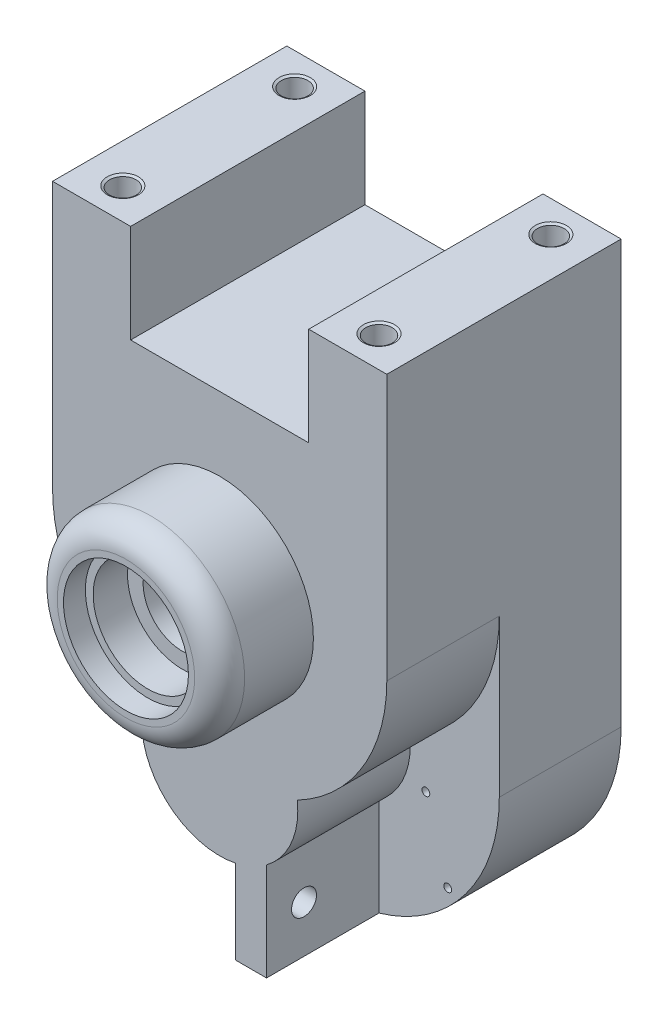
from build123d import *

# Parameters (mm, degrees)
EXTRUS_O1_DEPTH                      = 36
ESBO_O2_R                            = 30
EXTRUS_O3_DEPTH                      = 30
EXTRUS_O4_START                      = 39
EXTRUS_O4_DEPTH                      = 39
ESBO_O4_R                            = 20
CORTE_EXTRUS_O1_DEPTH                = 7
CORTE_EXTRUS_O3_DEPTH                = 67
ESBO_O7_R                            = 43.5
CORTE_EXTRUS_O4_DEPTH                = 31
EXTRUS_O5_START                      = 6
ESBO_O8_R                            = 30
EXTRUS_O5_DEPTH                      = 6
EXTRUS_O6_START                      = 6
ESBO_O9_R                            = 25
EXTRUS_O6_DEPTH                      = 6
ESBO_O10_R                           = 17.5
CORTE_EXTRUS_O5_DEPTH                = 9
ESBO_O5_R                            = 12.5
CORTE_EXTRUS_O2_DEPTH                = 153.414935292
ESBO_O11_R                           = 16
CORTE_EXTRUS_O6_DEPTH                = 9
ESBO_O12_R                           = 13
CORTE_EXTRUS_O7_DEPTH                = 2
CORTE_EXTRUS_O8_START                = -11
ESBO_O13_R                           = 17.5
CORTE_EXTRUS_O8_DEPTH                = 11
FILETE1_R                            = 5
FILETE2_R                            = 8
FURO_DE_DI_METRO_4_5_4_5_1_D         = 4.5
FURO_DE_DI_METRO_4_5_4_5_1_DEPTH     = 15
FURO_DE_DI_METRO_4_5_4_5_1_TIP       = 1.351936393
ESBO_O18_R                           = 2.5
CORTE_EXTRUS_O9_DEPTH                = 12
FURO_ROSCADO_DE_M10X1_51_D           = 8.5
FURO_ROSCADO_DE_M10X1_51_DEPTH       = 27.5
FURO_ROSCADO_DE_M10X1_51_CSINK_D     = 10
FURO_ROSCADO_DE_M10X1_51_CSINK_ANGLE = 118
FURO_ROSCADO_DE_M10X1_51_TIP         = 2.553657631
EXTRUS_O8_DEPTH                      = 36
ESBO_O24_R                           = 4
CORTE_EXTRUS_O12_DEPTH               = 10
FURO_ROSCADO_DE_M3X0_51_D            = 2.5
FURO_ROSCADO_DE_M3X0_51_DEPTH        = 7
FURO_ROSCADO_DE_M3X0_51_TIP          = 0.751075774


# Read off the part's stored shape, not the designer's step: Esboço-padrão1
with BuildPart() as part:
    # Esboço1 → Extrusão1 (new body)
    with BuildSketch(Plane.XY):
        with BuildLine():
            Line((-28.5, 53.5), (-28.5, 85))
            Line((-28.5, 85), (-53.5, 85))
            Line((-53.5, 85), (-53.5, 0))
            ThreePointArc((-53.5, 0), (-45.776334167, -27.690742681), (-24.835430646, -47.38619403))
            ThreePointArc((-24.835430646, -47.38619403), (0, -75.25), (24.835430646, -47.38619403))
            ThreePointArc((24.835430646, -47.38619403), (45.776334167, -27.690742681), (53.5, 0))
            Line((53.5, 0), (53.5, 85))
            Line((53.5, 85), (28.5, 85))
            Line((28.5, 85), (28.5, 53.5))
            Line((28.5, 53.5), (-28.5, 53.5))
        make_face()
    extrude(amount=EXTRUS_O1_DEPTH)

    # Esboço2 → Extrusão3 (add)
    with BuildSketch(Plane.XY.offset(36)):
        with Locations(Location((0, 0, 0), (0, 0, 180))):
            Circle(ESBO_O2_R)
    extrude(amount=EXTRUS_O3_DEPTH)

    # Esboço3 → Extrusão4 (add)
    with BuildSketch(Plane(origin=(0, 0, 0), x_dir=(-1, 0, 0), z_dir=(0, 0, -1)).offset(EXTRUS_O4_START)):
        with BuildLine():
            ThreePointArc((47.233297312, -25.125), (51.90968795, -12.947366408), (53.5, 0))
            ThreePointArc((53.5, 0), (37.83021276, 37.830212827), (-9.4e-08, 53.5))
            ThreePointArc((-9.4e-08, 53.5), (-37.830212827, 37.83021276), (-53.5, 0))
            ThreePointArc((-53.5, 0), (-51.90968795, -12.947366408), (-47.233297312, -25.125))
            ThreePointArc((-47.233297312, -25.125), (0, 3.25), (47.233297312, -25.125))
        make_face()
        with BuildLine():
            ThreePointArc((24.835430646, -47.38619403), (37.714262253, -37.945809027), (47.233297312, -25.125))
            ThreePointArc((47.233297312, -25.125), (0, 3.25), (-47.233297312, -25.125))
            ThreePointArc((-47.233297312, -25.125), (-37.714262253, -37.945809027), (-24.835430646, -47.38619403))
            ThreePointArc((-24.835430646, -47.38619403), (0, -53.5), (24.835430646, -47.38619403))
        make_face()
        with BuildLine():
            Line((-53.5, 0), (-53.5, -50.25))
            ThreePointArc((-53.5, -50.25), (-51.90968795, -37.302633592), (-47.233297312, -25.125))
            ThreePointArc((-47.233297312, -25.125), (-51.90968795, -12.947366408), (-53.5, 0))
        make_face()
        with BuildLine():
            Line((53.5, -50.25), (53.5, 0))
            ThreePointArc((53.5, 0), (51.90968795, -12.947366408), (47.233297312, -25.125))
            ThreePointArc((47.233297312, -25.125), (51.90968795, -37.302633592), (53.5, -50.25))
        make_face()
        with BuildLine():
            ThreePointArc((-53.5, -50.25), (0, -103.75), (53.5, -50.25))
            ThreePointArc((53.5, -50.25), (51.90968795, -37.302633592), (47.233297312, -25.125))
            ThreePointArc((47.233297312, -25.125), (37.714262253, -37.945809027), (24.835430646, -47.38619403))
            ThreePointArc((24.835430646, -47.38619403), (0, -75.25), (-24.835430646, -47.38619403))
            ThreePointArc((-24.835430646, -47.38619403), (-37.714262253, -37.945809027), (-47.233297312, -25.125))
            ThreePointArc((-47.233297312, -25.125), (-51.90968795, -37.302633592), (-53.5, -50.25))
        make_face()
        with BuildLine():
            ThreePointArc((-24.835430646, -47.38619403), (0, -75.25), (24.835430646, -47.38619403))
            ThreePointArc((24.835430646, -47.38619403), (0, -53.5), (-24.835430646, -47.38619403))
        make_face()
        with BuildLine():
            ThreePointArc((-53.5, 0), (-37.830212827, 37.83021276), (-9.4e-08, 53.5))
            Line((-9.4e-08, 53.5), (-28.5, 53.5))
            Line((-28.5, 53.5), (-28.5, 85))
            Line((-28.5, 85), (-53.5, 85))
            Line((-53.5, 85), (-53.5, 0))
        make_face()
        with BuildLine():
            ThreePointArc((-9.4e-08, 53.5), (37.83021276, 37.830212827), (53.5, 0))
            Line((53.5, 0), (53.5, 85))
            Line((53.5, 85), (28.5, 85))
            Line((28.5, 85), (28.5, 53.5))
            Line((28.5, 53.5), (-9.4e-08, 53.5))
        make_face()
    extrude(amount=-EXTRUS_O4_DEPTH)

    # Esboço4 → Corte-extrusão1 (cut)
    with BuildSketch(Plane.XY.offset(66)):
        Circle(ESBO_O4_R)
    extrude(amount=-CORTE_EXTRUS_O1_DEPTH, mode=Mode.SUBTRACT)

    # Esboço6 → Corte-extrusão3 (cut)
    with BuildSketch(Plane(origin=(0, 0, -39), x_dir=(-1, 0, 0), z_dir=(0, 0, -1))):
        with BuildLine():
            ThreePointArc((14.313265838, -41.077736318), (0, 43.5), (-14.313265838, -41.077736318))
            ThreePointArc((-14.313265838, -41.077736318), (0, -67.25), (14.313265838, -41.077736318))
        make_face()
    extrude(amount=-CORTE_EXTRUS_O3_DEPTH, mode=Mode.SUBTRACT)

    # Esboço7 → Corte-extrusão4 (cut)
    with BuildSketch(Plane(origin=(0, 0, -39), x_dir=(-1, 0, 0), z_dir=(0, 0, -1))):
        with Locations((0, -50.25)):
            Circle(ESBO_O7_R)
    extrude(amount=-CORTE_EXTRUS_O4_DEPTH, mode=Mode.SUBTRACT)

    # Esboço8 → Extrusão5 (add)
    with BuildSketch(Plane(origin=(0, 0, 28), x_dir=(-1, 0, 0), z_dir=(0, 0, -1)).offset(EXTRUS_O5_START)):
        Circle(ESBO_O8_R)
    extrude(amount=-EXTRUS_O5_DEPTH)

    # Esboço9 → Extrusão6 (add)
    with BuildSketch(Plane(origin=(0, 0, 28), x_dir=(-1, 0, 0), z_dir=(0, 0, -1)).offset(EXTRUS_O6_START)):
        with Locations((0, -50.25)):
            Circle(ESBO_O9_R)
    extrude(amount=-EXTRUS_O6_DEPTH)

    # Esboço10 → Corte-extrusão5 (cut)
    with BuildSketch(Plane(origin=(0, 0, 22), x_dir=(-1, 0, 0), z_dir=(0, 0, -1))):
        Circle(ESBO_O10_R)
    extrude(amount=-CORTE_EXTRUS_O5_DEPTH, mode=Mode.SUBTRACT)

    # Esboço5 → Corte-extrusão2 (cut, through all)
    with BuildSketch(Plane.XY.offset(59)):
        Circle(ESBO_O5_R)
    extrude(amount=-CORTE_EXTRUS_O2_DEPTH, mode=Mode.SUBTRACT)

    # Esboço11 → Corte-extrusão6 (cut)
    with BuildSketch(Plane(origin=(0, 0, 22), x_dir=(-1, 0, 0), z_dir=(0, 0, -1))):
        with Locations((0, -50.25)):
            Circle(ESBO_O11_R)
    extrude(amount=-CORTE_EXTRUS_O6_DEPTH, mode=Mode.SUBTRACT)

    # Esboço12 → Corte-extrusão7 (cut)
    with BuildSketch(Plane(origin=(0, 0, 31), x_dir=(-1, 0, 0), z_dir=(0, 0, -1))):
        with Locations((0, -50.25)):
            Circle(ESBO_O12_R)
    extrude(amount=-CORTE_EXTRUS_O7_DEPTH, mode=Mode.SUBTRACT)

    # Esboço13 → Corte-extrusão8 (cut)
    with BuildSketch(Plane.XY.offset(59).offset(CORTE_EXTRUS_O8_START)):
        with Locations(Location((0, 0, 0), (0, 0, 180))):
            Circle(ESBO_O13_R)
    extrude(amount=CORTE_EXTRUS_O8_DEPTH, mode=Mode.SUBTRACT)

    # Filete1
    filete1_edges = [part.edges().sort_by_distance(p)[0] for p in [
        (-11.124160039, -27.861318408, 25),
        (11.124160039, -27.861318408, 25),
    ]]
    fillet(filete1_edges, radius=FILETE1_R)

    # Filete2
    filete2_edges = [part.edges().sort_by_distance(p)[0] for p in [
        (30, 0, 66),
    ]]
    fillet(filete2_edges, radius=FILETE2_R)

    # Esboço15 → Furo roscado de M5x0.81 (revolve, cut)
    with BuildSketch(Plane(origin=(0, 48.5, -39), x_dir=(0, 1, 0), z_dir=(1, 0, 0))):
        Polygon((0, 0), (0, 26.2618073), (2.1, 25), (2.1, 0), align=None)
    revolve(axis=Axis((0, 48.5, -45.35), (0, 0, 1)), mode=Mode.SUBTRACT)

    # Esboço-padrão1 outline → Esboço-padrão1 (revolve, cut)
    with BuildSketch(Plane(origin=(-25, 48.5, 0), x_dir=(1, 0, 0), z_dir=(0, -1, 0))):
        Polygon((2.1, -39), (2.1, -14), (0, -12.7381927), (0, -39), align=None)
    revolve(axis=Axis((-25, 48.5, 0), (0, 0, 1)), mode=Mode.SUBTRACT)

    # Esbo_o-padr_o1 2 outline → Esbo_o-padr_o1 2 (revolve, cut)
    with BuildSketch(Plane(origin=(-48.5, 40, 0), x_dir=(1, 0, 0), z_dir=(0, -1, 0))):
        Polygon((2.1, -39), (2.1, -14), (0, -12.7381927), (0, -39), align=None)
    revolve(axis=Axis((-48.5, 40, 0), (0, 0, 1)), mode=Mode.SUBTRACT)

    # Esbo_o-padr_o1 3 outline → Esbo_o-padr_o1 3 (revolve, cut)
    with BuildSketch(Plane(origin=(-48.5, -40, 0), x_dir=(1, 0, 0), z_dir=(0, -1, 0))):
        Polygon((2.1, -39), (2.1, -14), (0, -12.7381927), (0, -39), align=None)
    revolve(axis=Axis((-48.5, -40, 0), (0, 0, 1)), mode=Mode.SUBTRACT)

    # Esbo_o-padr_o1 4 outline → Esbo_o-padr_o1 4 (revolve, cut)
    with BuildSketch(Plane(origin=(-34.294678888, -84.544678888, 0), x_dir=(1, 0, 0), z_dir=(0, -1, 0))):
        Polygon((2.1, -39), (2.1, -14), (0, -12.7381927), (0, -39), align=None)
    revolve(axis=Axis((-34.294678888, -84.544678888, 0), (0, 0, 1)), mode=Mode.SUBTRACT)

    # Esbo_o-padr_o1 5 outline → Esbo_o-padr_o1 5 (revolve, cut)
    with BuildSketch(Plane.XZ.offset(98.75)):
        Polygon((2.1, -39), (2.1, -14), (0, -12.7381927), (0, -39), align=None)
    revolve(axis=Axis((0, -98.75, 0), (0, 0, 1)), mode=Mode.SUBTRACT)

    # Esbo_o-padr_o1 6 outline → Esbo_o-padr_o1 6 (revolve, cut)
    with BuildSketch(Plane(origin=(34.294678888, -84.544678888, 0), x_dir=(1, 0, 0), z_dir=(0, -1, 0))):
        Polygon((2.1, -39), (2.1, -14), (0, -12.7381927), (0, -39), align=None)
    revolve(axis=Axis((34.294678888, -84.544678888, 0), (0, 0, 1)), mode=Mode.SUBTRACT)

    # Esbo_o-padr_o1 7 outline → Esbo_o-padr_o1 7 (revolve, cut)
    with BuildSketch(Plane(origin=(48.5, -40, 0), x_dir=(1, 0, 0), z_dir=(0, -1, 0))):
        Polygon((2.1, -39), (2.1, -14), (0, -12.7381927), (0, -39), align=None)
    revolve(axis=Axis((48.5, -40, 0), (0, 0, 1)), mode=Mode.SUBTRACT)

    # Esbo_o-padr_o1 8 outline → Esbo_o-padr_o1 8 (revolve, cut)
    with BuildSketch(Plane(origin=(48.5, 40, 0), x_dir=(1, 0, 0), z_dir=(0, -1, 0))):
        Polygon((2.1, -39), (2.1, -14), (0, -12.7381927), (0, -39), align=None)
    revolve(axis=Axis((48.5, 40, 0), (0, 0, 1)), mode=Mode.SUBTRACT)

    # Esbo_o-padr_o1 9 outline → Esbo_o-padr_o1 9 (revolve, cut)
    with BuildSketch(Plane(origin=(25, 48.5, 0), x_dir=(1, 0, 0), z_dir=(0, -1, 0))):
        Polygon((2.1, -39), (2.1, -14), (0, -12.7381927), (0, -39), align=None)
    revolve(axis=Axis((25, 48.5, 0), (0, 0, 1)), mode=Mode.SUBTRACT)

    # Esbo_o-padr_o1 10 outline → Esbo_o-padr_o1 10 (revolve, cut)
    with BuildSketch(Plane(origin=(-48.5, -0.875, 0), x_dir=(1, 0, 0), z_dir=(0, -1, 0))):
        Polygon((2.1, -39), (2.1, -14), (0, -12.7381927), (0, -39), align=None)
    revolve(axis=Axis((-48.5, -0.875, 0), (0, 0, 1)), mode=Mode.SUBTRACT)

    # Esbo_o-padr_o1 11 outline → Esbo_o-padr_o1 11 (revolve, cut)
    with BuildSketch(Plane(origin=(48.5, -0.875, 0), x_dir=(1, 0, 0), z_dir=(0, -1, 0))):
        Polygon((2.1, -39), (2.1, -14), (0, -12.7381927), (0, -39), align=None)
    revolve(axis=Axis((48.5, -0.875, 0), (0, 0, 1)), mode=Mode.SUBTRACT)

    # Furo de diâmetro Ø4.5 (4.5)1
    with Locations(Plane(origin=(-10, 48.5, -39), x_dir=(-1, 0, 0), z_dir=(0, 0, -1))):
        with Locations((0, 0), (0, -146.207876059)):
            Hole(FURO_DE_DI_METRO_4_5_4_5_1_D / 2, depth=FURO_DE_DI_METRO_4_5_4_5_1_DEPTH)
            with Locations((0, 0, -(FURO_DE_DI_METRO_4_5_4_5_1_DEPTH + FURO_DE_DI_METRO_4_5_4_5_1_TIP / 2))):  # 118° drill point
                Cone(0, FURO_DE_DI_METRO_4_5_4_5_1_D / 2, FURO_DE_DI_METRO_4_5_4_5_1_TIP, mode=Mode.SUBTRACT)

    # Esboço18 → Corte-extrusão9 (cut)
    with BuildSketch(Plane(origin=(0, 0, -39), x_dir=(-1, 0, 0), z_dir=(0, 0, -1))):
        with Locations((10, 48.5)):
            Circle(ESBO_O18_R)
        with Locations((10, -97.707876059)):
            Circle(ESBO_O18_R)
    extrude(amount=-CORTE_EXTRUS_O9_DEPTH, mode=Mode.SUBTRACT)

    # Furo roscado de M10x1.51
    with Locations(Plane(origin=(-41, 85, -29), x_dir=(0, 0, 1), z_dir=(0, 1, 0))):
        with Locations((0, 0), (0, 82), (55, 0), (55, 82)):
            CounterSinkHole(FURO_ROSCADO_DE_M10X1_51_D / 2, FURO_ROSCADO_DE_M10X1_51_CSINK_D / 2, depth=FURO_ROSCADO_DE_M10X1_51_DEPTH, counter_sink_angle=FURO_ROSCADO_DE_M10X1_51_CSINK_ANGLE)
            with Locations((0, 0, -(FURO_ROSCADO_DE_M10X1_51_DEPTH + FURO_ROSCADO_DE_M10X1_51_TIP / 2))):  # 118° drill point
                Cone(0, FURO_ROSCADO_DE_M10X1_51_D / 2, FURO_ROSCADO_DE_M10X1_51_TIP, mode=Mode.SUBTRACT)

    # Esboço23 → Extrusão8 (add)
    with BuildSketch(Plane.XY):
        with BuildLine():
            Line((5, -74.744897428), (5, -101.604162441))
            Line((5, -101.604162441), (15, -101.604162441))
            Line((15, -101.604162441), (15, -70.25))
            ThreePointArc((15, -70.25), (10.249440264, -73.052389662), (5, -74.744897428))
        make_face()
    extrude(amount=EXTRUS_O8_DEPTH)

    # Esboço24 → Corte-extrusão12 (cut)
    with BuildSketch(Plane.ZY.offset(-5)):
        with Locations((24, -86.604162441)):
            Circle(ESBO_O24_R)
    extrude(amount=-CORTE_EXTRUS_O12_DEPTH, mode=Mode.SUBTRACT)

    # Furo roscado de M3x0.51
    with Locations(Plane(origin=(37, -83.604162441, 0), x_dir=(1, 0, 0), z_dir=(0, 0, 1))):
        with Locations((0, 0), (-6.998551924, 23.129364366)):
            Hole(FURO_ROSCADO_DE_M3X0_51_D / 2, depth=FURO_ROSCADO_DE_M3X0_51_DEPTH)
            with Locations((0, 0, -(FURO_ROSCADO_DE_M3X0_51_DEPTH + FURO_ROSCADO_DE_M3X0_51_TIP / 2))):  # 118° drill point
                Cone(0, FURO_ROSCADO_DE_M3X0_51_D / 2, FURO_ROSCADO_DE_M3X0_51_TIP, mode=Mode.SUBTRACT)


solid = part.part
